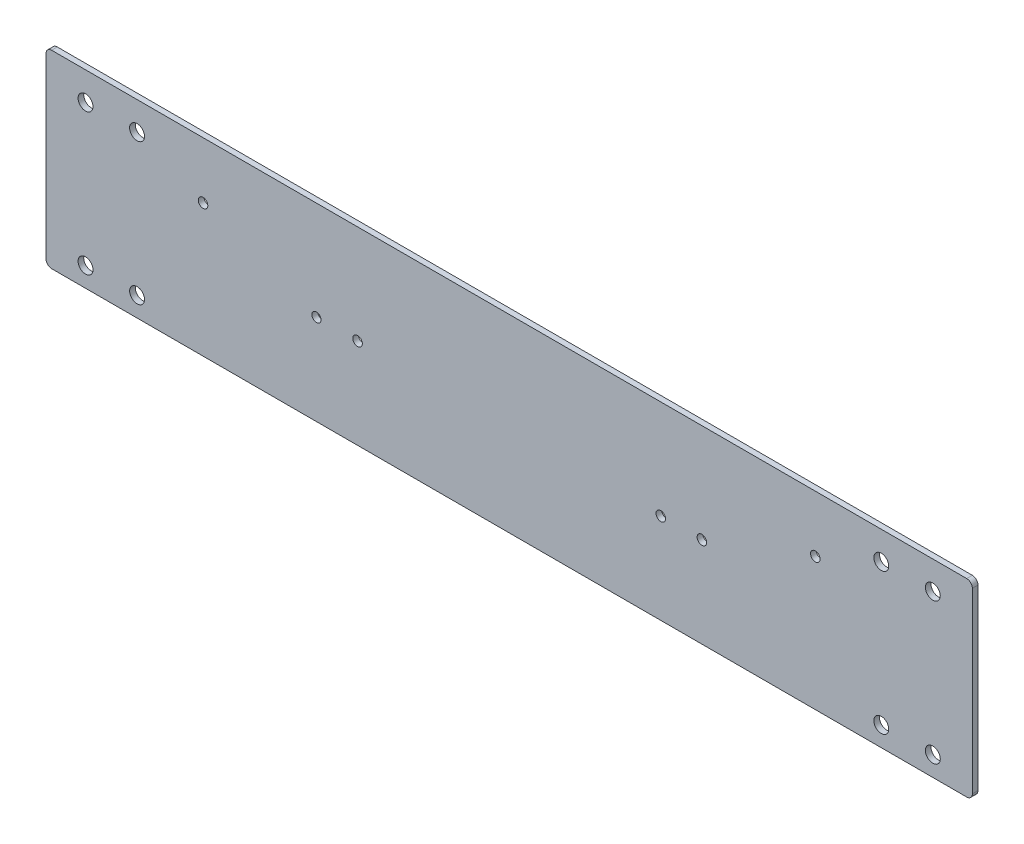
from build123d import *

# Parameters (mm, degrees)
SKETCH1_W           = 1041.4
SKETCH1_H           = 212.725
BOSS_EXTRUDE1_DEPTH = 6.35
SKETCH4_R           = 8.382
CUT_EXTRUDE1_DEPTH  = 532.490163508
SKETCH5_R           = 5.159375
SKETCH5_R_2         = 5.3578125
CUT_EXTRUDE2_DEPTH  = 532.490163508
FILLET1_R           = 6.35


with BuildPart() as part:
    # Sketch1 → Boss-Extrude1 (new body)
    with BuildSketch(Plane.XY):
        Rectangle(SKETCH1_W, SKETCH1_H)
    extrude(amount=BOSS_EXTRUDE1_DEPTH)

    # Sketch4 → Cut-Extrude1 (cut, through all)
    with BuildSketch(Plane.XY.offset(6.35)):
        with Locations((476.25, 74.6125)):
            Circle(SKETCH4_R)
        with Locations((418.310341604, 74.6125)):
            Circle(SKETCH4_R)
        with Locations((-476.25, 74.6125)):
            Circle(SKETCH4_R)
        with Locations((-418.338, 74.6125)):
            Circle(SKETCH4_R)
        with Locations((476.25, -84.1375)):
            Circle(SKETCH4_R)
        with Locations((418.310341686, -84.1375)):
            Circle(SKETCH4_R)
        with Locations((-476.25, -84.1375)):
            Circle(SKETCH4_R)
        with Locations((-418.310341686, -84.1375)):
            Circle(SKETCH4_R)
    extrude(amount=-CUT_EXTRUDE1_DEPTH, mode=Mode.SUBTRACT)

    # Sketch5 → Cut-Extrude2 (cut, through all)
    with BuildSketch(Plane.XY.offset(6.35)):
        with Locations((-216.662, -4.7625)):
            Circle(SKETCH5_R)
        with Locations((-170.434, -4.7625)):
            Circle(SKETCH5_R_2)
        with Locations((170.434, -4.7625)):
            Circle(SKETCH5_R_2)
        with Locations((216.662, -4.7625)):
            Circle(SKETCH5_R_2)
        with Locations((344.17, 42.8625)):
            Circle(SKETCH5_R_2)
        with Locations((-344.17, 42.8625)):
            Circle(SKETCH5_R_2)
    extrude(amount=-CUT_EXTRUDE2_DEPTH, mode=Mode.SUBTRACT)

    # Fillet1
    fillet1_edges = [part.edges().sort_by_distance(p)[0] for p in [
        (520.7, 106.3625, 3.175),
        (520.7, -106.3625, 3.175),
        (-520.7, -106.3625, 3.175),
        (-520.7, 106.3625, 3.175),
    ]]
    fillet(fillet1_edges, radius=FILLET1_R)


solid = part.part
